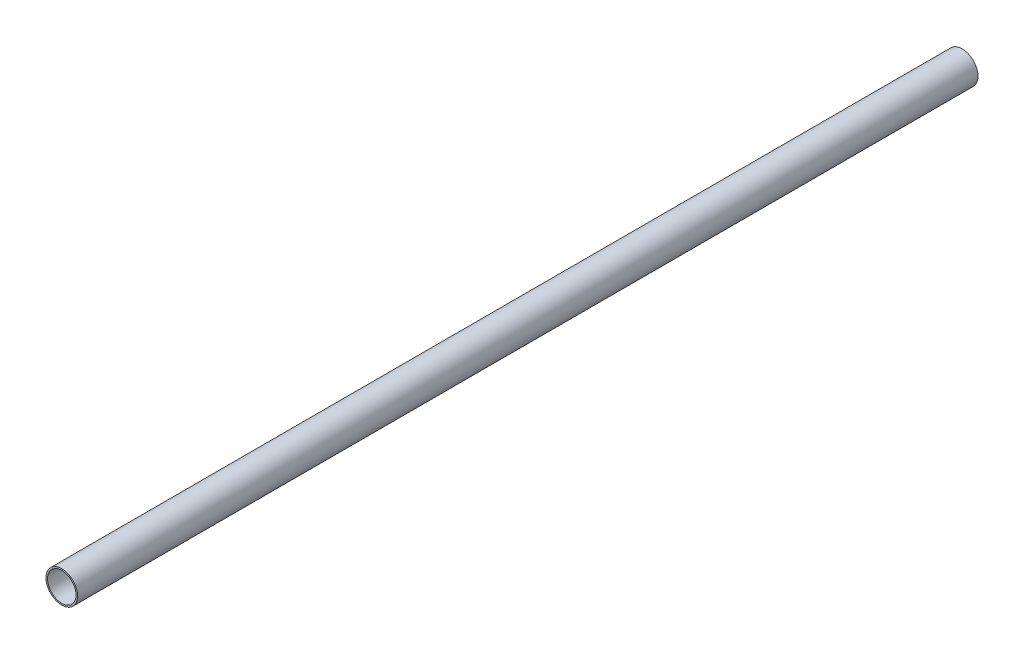
from build123d import *

# Parameters (mm, degrees)
SKETCH1_R           = 15
BOSS_EXTRUDE1_DEPTH = 854
SKETCH2_R           = 13.5
CUT_EXTRUDE1_DEPTH  = 855.263425414


with BuildPart() as part:
    # Sketch1 → Boss-Extrude1 (new body)
    with BuildSketch(Plane.XY):
        Circle(SKETCH1_R)
    extrude(amount=BOSS_EXTRUDE1_DEPTH)

    # Sketch2 → Cut-Extrude1 (cut, through all)
    with BuildSketch(Plane(origin=(0, 0, 0), x_dir=(-1, 0, 0), z_dir=(0, 0, -1))):
        Circle(SKETCH2_R)
    extrude(amount=-CUT_EXTRUDE1_DEPTH, mode=Mode.SUBTRACT)


solid = part.part
